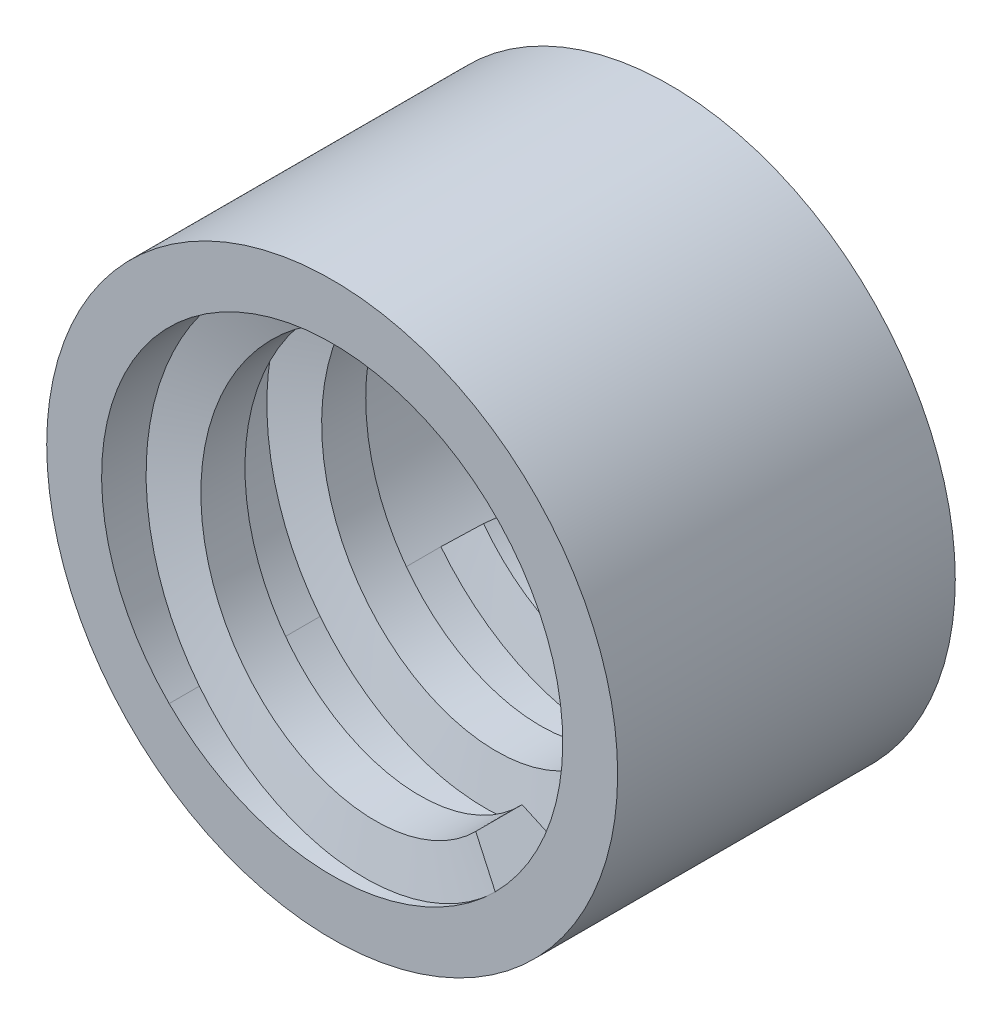
from build123d import *

# Parameters (mm, degrees)
EXTRUDE_1_DEPTH          = 12.375
EXTRUDE_1_DEPTH_BACK     = 3
SKETCH_1_R               = 13
CUT_EXTRUDE_1_DEPTH      = 20
CUT_EXTRUDE_1_DEPTH_BACK = 10
SKETCH_2_R               = 10.5
SWEEP_1_PITCH            = 5.5


with BuildPart() as part:
    # 草图1 → 凸台-拉伸1 (new, two sides: drawn at the far end of the back side and taken through both)
    with BuildSketch(Plane.XY.offset(-EXTRUDE_1_DEPTH_BACK)):
        Circle(SKETCH_1_R)
    extrude(amount=EXTRUDE_1_DEPTH + EXTRUDE_1_DEPTH_BACK)

    # 草图2 → 切除-拉伸1 (cut, two sides: drawn at the far end of the back side and taken through both)
    with BuildSketch(Plane.XY.offset(-CUT_EXTRUDE_1_DEPTH_BACK)):
        Circle(SKETCH_2_R)
    extrude(amount=CUT_EXTRUDE_1_DEPTH + CUT_EXTRUDE_1_DEPTH_BACK, mode=Mode.SUBTRACT)

    # 扫描1: the profile of 草图4 screwed along a right-hand helix of 2.25 turns, 14 arcs to a turn; built about Z, then put on its axis
    sweep_1_z = Axis((0, 0, 0), (0, 0, 1))
    sweep_1_corners = [(10.5, 0, 0), (10.5, 0.249236025, -2.989628974), (8.5, 0.207696687, -2.491357479), (8.5, 0.041539337, -0.498271496)]
    with BuildLine(mode=Mode.PRIVATE) as sweep_1_profile:
        Line(sweep_1_corners[0], sweep_1_corners[1])
        Line(sweep_1_corners[1], sweep_1_corners[2])
        Line(sweep_1_corners[2], sweep_1_corners[3])
        Line(sweep_1_corners[3], sweep_1_corners[0])
    sweep_1_cap = Face(sweep_1_profile.wire())
    sweep_1_turn_angles = [0, 12.857142857, 25.714285714, 38.571428571, 51.428571429, 64.285714286, 77.142857143, 90, 102.857142857, 115.714285714, 128.571428571, 141.428571429, 154.285714286, 167.142857143, 180, 192.857142857, 205.714285714, 218.571428571, 231.428571429, 244.285714286, 257.142857143, 270, 282.857142857, 295.714285714, 308.571428571, 321.428571429, 334.285714286, 347.142857143, 360]
    sweep_1_turn_weights = [1, 0.9749279121818236, 1, 0.9749279121818236, 1, 0.9749279121818236, 1, 0.9749279121818236, 1, 0.9749279121818236, 1, 0.9749279121818236, 1, 0.9749279121818236, 1, 0.9749279121818236, 1, 0.9749279121818236, 1, 0.9749279121818236, 1, 0.9749279121818236, 1, 0.9749279121818237, 1, 0.9749279121818236, 1, 0.9749279121818236, 1]
    sweep_1_turn_rails = [Edge.make_bspline([Vector(p[0], p[1], 0).rotate(sweep_1_z, sweep_1_turn_angles[k]) / sweep_1_turn_weights[k] + Vector(0, 0, p[2] + SWEEP_1_PITCH * sweep_1_turn_angles[k] / 360) for k in range(29)], [0, 0, 0, 1, 1, 2, 2, 3, 3, 4, 4, 5, 5, 6, 6, 7, 7, 8, 8, 9, 9, 10, 10, 11, 11, 12, 12, 13, 13, 14, 14, 14], 2, sweep_1_turn_weights) for p in sweep_1_corners]
    sweep_1_turn_sides = [Face.make_surface_from_curves(sweep_1_turn_rails[p[0]], sweep_1_turn_rails[p[1]]) for p in [(0, 1), (1, 2), (2, 3), (3, 0)]]
    sweep_1_last_angles = [720, 732.857142857, 745.714285714, 758.571428571, 771.428571429, 784.285714286, 797.142857143, 803.571428571, 810]
    sweep_1_last_weights = [1, 0.9749279121818237, 1, 0.9749279121818235, 1, 0.9749279121818237, 1, 0.9937122098932412, 1]
    sweep_1_last_rails = [Edge.make_bspline([Vector(p[0], p[1], 0).rotate(sweep_1_z, sweep_1_last_angles[k]) / sweep_1_last_weights[k] + Vector(0, 0, p[2] + SWEEP_1_PITCH * sweep_1_last_angles[k] / 360) for k in range(9)], [0, 0, 0, 1, 1, 2, 2, 3, 3, 4, 4, 4], 2, sweep_1_last_weights) for p in sweep_1_corners]
    sweep_1_last_sides = [Face.make_surface_from_curves(sweep_1_last_rails[p[0]], sweep_1_last_rails[p[1]]) for p in [(0, 1), (1, 2), (2, 3), (3, 0)]]
    sweep_1 = Plane(origin=(0, 0, 0), x_dir=(-0.7071067811865414, -0.7071067811865537, 0), z_dir=(0, 0, 1)) * Solid(Shell([*[p.moved(Location((0, 0, SWEEP_1_PITCH * i))) for i in range(2) for p in sweep_1_turn_sides], *sweep_1_last_sides, sweep_1_cap, sweep_1_cap.rotate(sweep_1_z, 810).moved(Location((0, 0, SWEEP_1_PITCH * 810 / 360)))]))
    add(sweep_1)


solid = part.part
